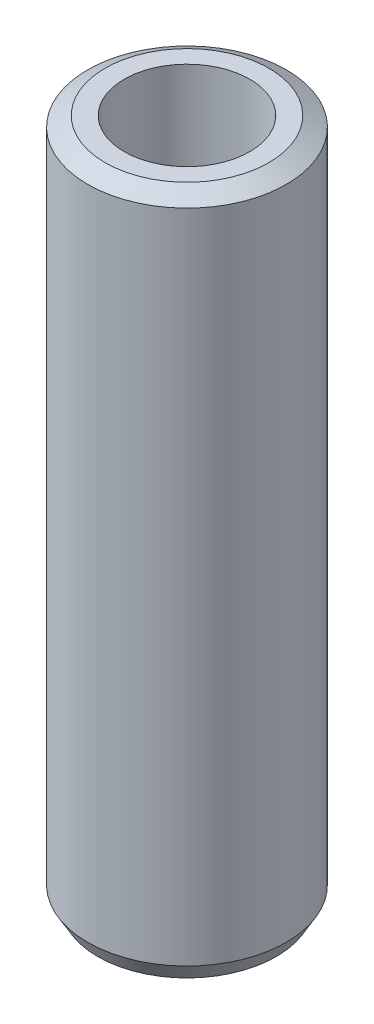
from build123d import *
from OCP.BRepFilletAPI import BRepFilletAPI_MakeChamfer

# Parameters (mm, degrees)
SKETCH1_R           = 42.5
BOSS_EXTRUDE1_DEPTH = 292.654685316
SKETCH2_R           = 26.871955692
CUT_EXTRUDE1_DEPTH  = 299.762890663
CHAMFER1_SIZE       = 4.309301065
CHAMFER1_SIZE2      = 7.463928389


with BuildPart() as part:
    # Sketch1 → Boss-Extrude1 (new body)
    with BuildSketch(Plane(origin=(0, 0, 0), x_dir=(1, 0, 0), z_dir=(0, 1, 0))):
        Circle(SKETCH1_R)
    extrude(amount=BOSS_EXTRUDE1_DEPTH)

    # Sketch2 → Cut-Extrude1 (cut, through all)
    with BuildSketch(Plane(origin=(0, 0, 0), x_dir=(1, 0, 0), z_dir=(0, 1, 0))):
        Circle(SKETCH2_R)
    extrude(amount=CUT_EXTRUDE1_DEPTH, mode=Mode.SUBTRACT)

    # Chamfer1: one chamfer whose edges measure the first distance from different faces: ONE call of the kernel's chamfer builder (chamfer() names one face for all edges)
    chamfer1_edges_1 = [part.edges().sort_by_distance(p)[0] for p in [
        (-42.5, 292.654685316, 0),
    ]]
    chamfer1_side_1 = [part.faces().sort_by_distance(p)[0] for p in [
        (-42.5, 146.327342658, 0),
    ]]
    chamfer1_edges_2 = [part.edges().sort_by_distance(p)[0] for p in [
        (-42.5, 0, 0),
    ]]
    chamfer1_side_2 = [part.faces().sort_by_distance(p)[0] for p in [
        (-41.297918472, 0, 0),
    ]]
    chamfer1 = BRepFilletAPI_MakeChamfer(part.part.solid().wrapped)
    for e in chamfer1_edges_1:
        chamfer1.Add(CHAMFER1_SIZE, CHAMFER1_SIZE2, e.wrapped, chamfer1_side_1[0].wrapped)  # the first distance lies on this face
    for e in chamfer1_edges_2:
        chamfer1.Add(CHAMFER1_SIZE, CHAMFER1_SIZE2, e.wrapped, chamfer1_side_2[0].wrapped)  # the first distance lies on this face
    add(Compound.cast(chamfer1.Shape()), mode=Mode.REPLACE)


solid = part.part
